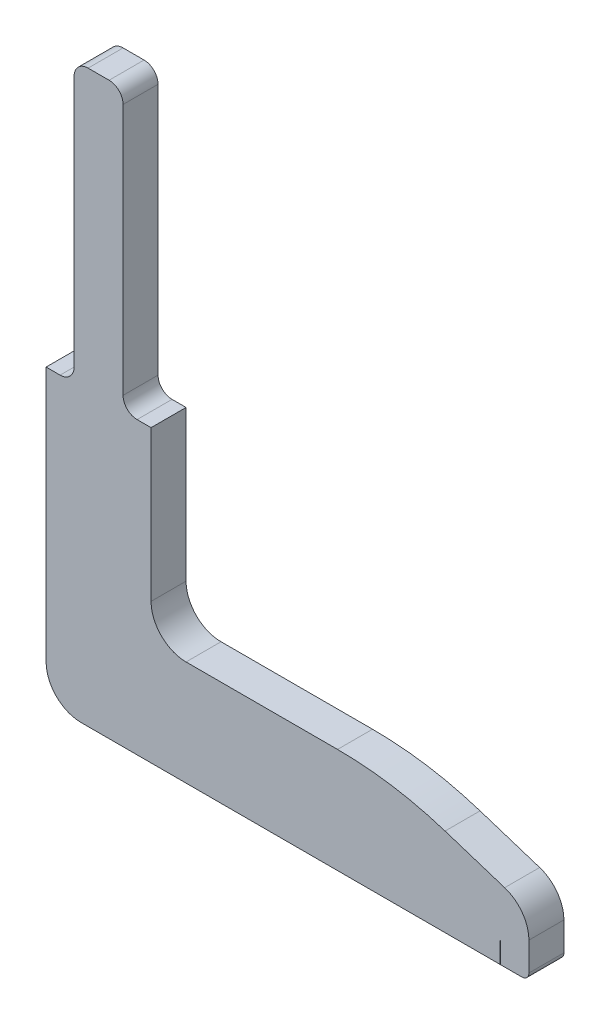
from build123d import *

# Parameters (mm, degrees)
BOSS_EXTRUDE1_DEPTH = 5
SKETCH2_W           = 0.1
SKETCH2_H           = 5
CUT_EXTRUDE2_DEPTH  = 3
FILLET1_R           = 2


with BuildPart() as part:
    # Sketch1 → Boss-Extrude1 (new body)
    with BuildSketch(Plane.XY):
        with BuildLine():
            Line((0, -1), (0, -36.5))
            ThreePointArc((0, -36.5), (1.464466094, -40.035533906), (5, -41.5))
            Line((5, -41.5), (68, -41.5))
            ThreePointArc((68, -41.5), (68.707106781, -41.207106781), (69, -40.5))
            Line((69, -40.5), (69, -36.429996046))
            ThreePointArc((69, -36.429996046), (68.042547906, -33.487580979), (65.53687743, -31.672054499))
            Line((65.53687743, -31.672054499), (57.01873992, -28.920584529))
            ThreePointArc((57.01873992, -28.920584529), (49.429079532, -27.108853154), (41.649965621, -26.5))
            Line((41.649965621, -26.5), (20, -26.5))
            ThreePointArc((20, -26.5), (16.464466094, -25.035533906), (15, -21.5))
            Line((15, -21.5), (15, -1))
            Line((15, -1), (15, 0))
            Line((15, 0), (14, 0))
            Line((14, 0), (11, 0))
            Line((11, 0), (11, 40))
            Line((11, 40), (4, 40))
            Line((4, 40), (4, 0))
            Line((4, 0), (1, 0))
            Line((1, 0), (0, 0))
            Line((0, 0), (0, -1))
        make_face()
    extrude(amount=BOSS_EXTRUDE1_DEPTH)

    # Sketch2 → Cut-Extrude2 (cut)
    with BuildSketch(Plane.XZ.offset(41.5)):
        with Locations((64.9, 2.5)):
            Rectangle(SKETCH2_W, SKETCH2_H)
    extrude(amount=-CUT_EXTRUDE2_DEPTH, mode=Mode.SUBTRACT)

    # Fillet1
    fillet1_edges = [part.edges().sort_by_distance(p)[0] for p in [
        (4, 40, 2.5),
        (11, 40, 2.5),
        (4, 0, 2.5),
        (11, 0, 2.5),
    ]]
    fillet(fillet1_edges, radius=FILLET1_R)


solid = part.part
